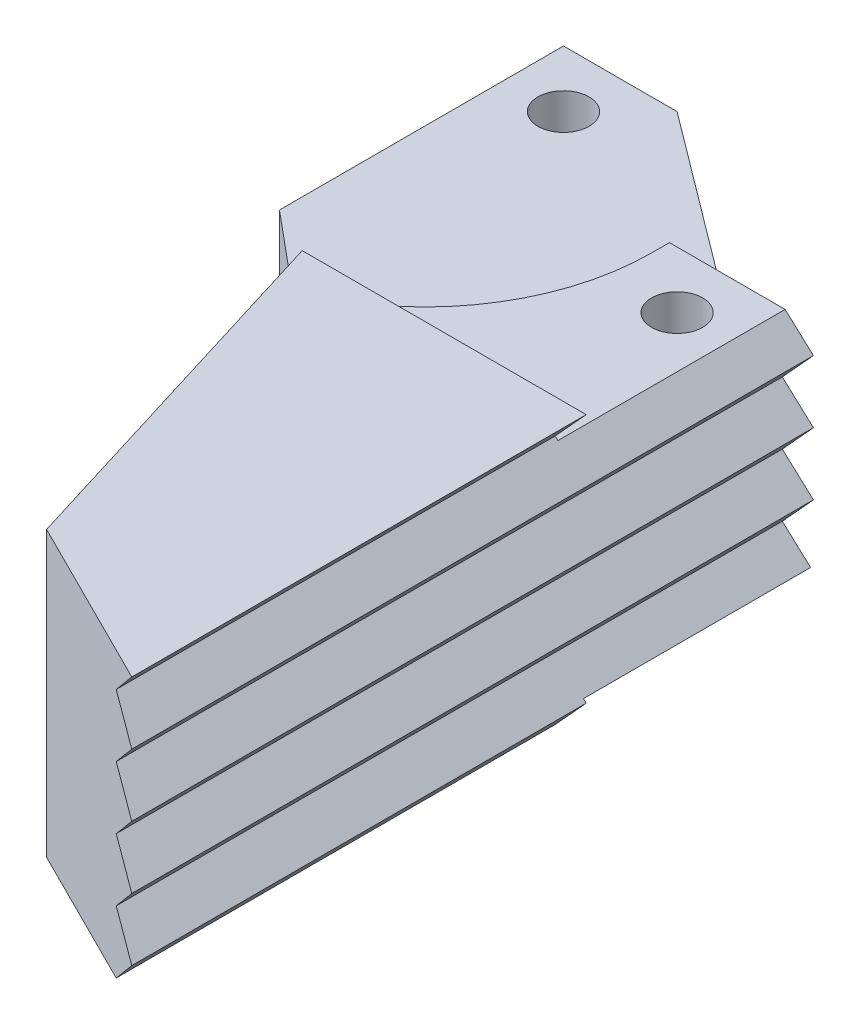
from build123d import *

# Parameters (mm, degrees)
BOSS_EXTRUDE1_DEPTH  = 12.5
SKETCH3_W            = 37
SKETCH3_H            = 20
CUT_EXTRUDE1_DEPTH   = 7.9
SKETCH4_W            = 37
SKETCH4_H            = 20
CUT_EXTRUDE2_DEPTH   = 7.9
SKETCH5_W            = 20
SKETCH5_H            = 18.55
BOSS_EXTRUDE2_DEPTH  = 12.675
BOSS_EXTRUDE3_DEPTH  = 9.2
M4_CLEARANCE_HOLE1_D = 4.5
CUT_EXTRUDE3_DEPTH   = 72.590851371
FILLET1_R            = 20


with BuildPart() as part:
    # Sketch2 → Boss-Extrude1 (new, symmetric)
    with BuildSketch(Plane(origin=(0, 0, 0), x_dir=(1, 0, 0), z_dir=(0, 1, 0))):
        Polygon((0, 0), (37, 0), (37, -60), (22, -52.5), (12, -20), (0, -10), align=None)
    extrude(amount=BOSS_EXTRUDE1_DEPTH, both=True)

    # Sketch3 → Cut-Extrude1 (cut)
    with BuildSketch(Plane(origin=(0, 12.5, 0), x_dir=(1, 0, 0), z_dir=(0, 1, 0))):
        with Locations((18.5, -10)):
            Rectangle(SKETCH3_W, SKETCH3_H)
    extrude(amount=-CUT_EXTRUDE1_DEPTH, mode=Mode.SUBTRACT)

    # Sketch4 → Cut-Extrude2 (cut)
    with BuildSketch(Plane(origin=(0, -12.5, 0), x_dir=(-1, 0, 0), z_dir=(0, -1, 0))):
        with Locations((-18.5, -10)):
            Rectangle(SKETCH4_W, SKETCH4_H)
    extrude(amount=-CUT_EXTRUDE2_DEPTH, mode=Mode.SUBTRACT)

    # Sketch5 → Boss-Extrude2 (add)
    with BuildSketch(Plane(origin=(37, 0, 0), x_dir=(0, 0, -1), z_dir=(1, 0, 0))):
        with Locations((-10, 0)):
            Rectangle(SKETCH5_W, SKETCH5_H)
    extrude(amount=-BOSS_EXTRUDE2_DEPTH)

    # Sketch10 → Boss-Extrude3 (add)
    with BuildSketch(Plane(origin=(0, 4.6, 0), x_dir=(1, 0, 0), z_dir=(0, 1, 0))):
        Polygon((30, 0), (10, 15), (0, 15), (0, 0), align=None)
    extrude(amount=-BOSS_EXTRUDE3_DEPTH)

    # M4 Clearance Hole1 (through all)
    with Locations(Plane(origin=(0, 9.275, 0), x_dir=(1, 0, 0), z_dir=(0, 1, 0))):
        with Locations((30, -5), (5, 10)):
            Hole(M4_CLEARANCE_HOLE1_D / 2)

    # Sketch8 → Cut-Extrude3 (cut, through all)
    with BuildSketch(Plane(origin=(0, 0, 0), x_dir=(-1, 0, 0), z_dir=(0, 0, -1))):
        Polygon((-34.261387212, 4), (-37, 7), (-37, 1.5), align=None)
        Polygon((-34.261387212, -1.5), (-37, 1.5), (-37, -4), align=None)
        Polygon((-34.261387212, 9.5), (-37, 12.5), (-37, 9.275), (-34.507862363, 9.275), align=None)
        Polygon((-34.507862363, 9.275), (-37, 9.275), (-37, 7), align=None)
        Polygon((-34.261387212, -7), (-37, -4), (-37, -9.275), (-36.753524849, -9.275), align=None)
        Polygon((-36.753524849, -9.275), (-37, -9.275), (-37, -9.5), align=None)
        Polygon((-34.261387212, -12.5), (-37, -9.5), (-37, -12.5), align=None)
    extrude(amount=-CUT_EXTRUDE3_DEPTH, mode=Mode.SUBTRACT)

    # Fillet1
    # the kernel refuses this fillet: 20 mm, written as the material it adds along each edge
    with BuildSketch(Plane(origin=(24.325, 41.571851206, 20), x_dir=(0, 0, -1), z_dir=(0, -1, 0))) as fillet1_piece_1_section:
        with BuildLine():
            CenterArc((18.468740482, -20), FILLET1_R, 90, 67.433839366)
            Line((0, -12.325), (-0.36937481, -12.1715))
            ThreePointArc((-0.36937481, -12.1715), (-0.4, -6.1625), (-0.4, 0))
            Line((-0.4, 0), (0, 0.4))
            Line((0, 0.4), (18.468740482, 0.4))
            Line((18.468740482, 0.4), (18.468740482, 0))
        make_face()
    fillet1_piece_1 = extrude(amount=50.846851206, mode=Mode.PRIVATE)
    fillet1_piece_1 = split(fillet1_piece_1, bisect_by=Plane(origin=(21.141865588, 9.275, 15.519731965), z_dir=(0, -1, 0)), keep=Keep.TOP, mode=Mode.PRIVATE)
    add(fillet1_piece_1)
    with BuildSketch(Plane(origin=(24.325, 9.275, 20), x_dir=(0, 0, -1), z_dir=(0, -1, 0))) as fillet1_piece_2_section:
        with BuildLine():
            CenterArc((18.468740482, -20), FILLET1_R, 90, 67.433839366)
            Line((0, -12.325), (-0.36937481, -12.1715))
            ThreePointArc((-0.36937481, -12.1715), (-0.4, -6.1625), (-0.4, 0))
            Line((-0.4, 0), (0, 0.4))
            Line((0, 0.4), (18.468740482, 0.4))
            Line((18.468740482, 0.4), (18.468740482, 0))
        make_face()
    fillet1_piece_2 = extrude(amount=50.846851206, mode=Mode.PRIVATE)
    fillet1_piece_2 = split(fillet1_piece_2, bisect_by=Plane(origin=(21.141865588, -9.275, 15.519731965), z_dir=(0, 1, 0)), keep=Keep.TOP, mode=Mode.PRIVATE)
    add(fillet1_piece_2)


solid = part.part
